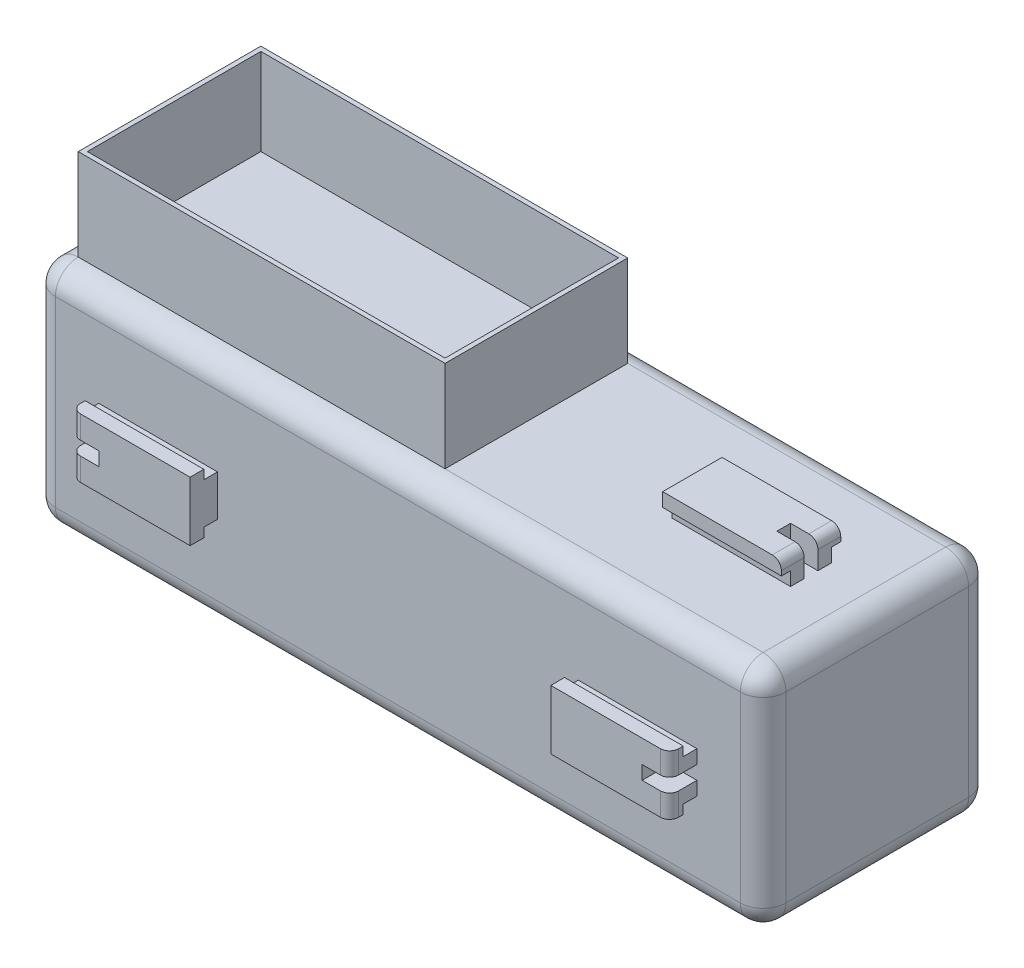
from build123d import *

# Parameters (mm, degrees)
SKETCH1_W               = 160
SKETCH1_H               = 50
BOSS_EXTRUDE1_DEPTH     = 25
SKETCH2_W               = 26
SKETCH2_H               = 13
CONNECTOR_BASE_DEPTH    = 6
SKETCH3_W               = 2
SKETCH3_H               = 3
DOVETAIL_CUT_DEPTH      = 151.851748415
FILLET1_R               = 2
SKETCH4_W               = 3
SKETCH4_H               = 6
CUT_EXTRUDE1_DEPTH      = 6
CIRPATTERN1_START       = -4.5
CIRPATTERN1_OUTLINE_W   = 20
CIRPATTERN1_OUTLINE_H   = 6
CIRPATTERN1_DEPTH       = 9
CIRPATTERN1_START_2     = -6.5
CIRPATTERN1_2_OUTLINE_W = 20
CIRPATTERN1_2_OUTLINE_H = 3
CIRPATTERN1_2_DEPTH     = 13
CIRPATTERN1_3_DEPTH     = 3
CIRPATTERN1_START_3     = 1.5
CIRPATTERN1_4_DEPTH     = 3
CIRPATTERN1_5_DEPTH     = 2
CIRPATTERN1_START_4     = 4.5
CIRPATTERN1_6_DEPTH     = 2
CIRPATTERN1_7_OUTLINE_W = 20
CIRPATTERN1_7_OUTLINE_H = 6
CIRPATTERN1_7_DEPTH     = 9
CIRPATTERN1_8_OUTLINE_W = 20
CIRPATTERN1_8_OUTLINE_H = 3
CIRPATTERN1_8_DEPTH     = 13
CIRPATTERN1_9_DEPTH     = 3
CIRPATTERN1_10_DEPTH    = 3
CIRPATTERN1_11_DEPTH    = 2
CIRPATTERN1_12_DEPTH    = 2
MIRROR1_START           = -4.5
MIRROR1_OUTLINE_W       = 20
MIRROR1_OUTLINE_H       = 6
MIRROR1_DEPTH           = 9
MIRROR1_START_2         = -6.5
MIRROR1_2_OUTLINE_W     = 20
MIRROR1_2_OUTLINE_H     = 3
MIRROR1_2_DEPTH         = 13
MIRROR1_3_DEPTH         = 3
MIRROR1_START_3         = 1.5
MIRROR1_4_DEPTH         = 3
MIRROR1_5_DEPTH         = 2
MIRROR1_START_4         = 4.5
MIRROR1_6_DEPTH         = 2
MIRROR1_7_OUTLINE_W     = 20
MIRROR1_7_OUTLINE_H     = 6
MIRROR1_7_DEPTH         = 9
MIRROR1_8_OUTLINE_W     = 20
MIRROR1_8_OUTLINE_H     = 3
MIRROR1_8_DEPTH         = 13
MIRROR1_9_DEPTH         = 3
MIRROR1_10_DEPTH        = 3
MIRROR1_11_DEPTH        = 2
MIRROR1_12_DEPTH        = 2
FILLET2_R               = 5
SKETCH5_W               = 26
SKETCH5_H               = 13
CUT_EXTRUDE2_DEPTH      = 103.454868113
SKETCH6_W               = 80.339783693
SKETCH6_H               = 40
BOSS_EXTRUDE2_DEPTH     = 20
SHELL1_T                = -1


# Read off the part's stored shape, not the designer's step: CirPattern1, Mirror1
with BuildPart() as part:
    # Sketch1 → Boss-Extrude1 (new, symmetric)
    with BuildSketch(Plane(origin=(0, 0, 0), x_dir=(1, 0, 0), z_dir=(0, 1, 0))):
        Rectangle(SKETCH1_W, SKETCH1_H)
    extrude(amount=BOSS_EXTRUDE1_DEPTH, both=True)

    # Sketch2 → connector base (add)
    with BuildSketch(Plane(origin=(0, 25, 0), x_dir=(1, 0, 0), z_dir=(0, 1, 0))):
        with Locations((-52.5, 0)):
            Rectangle(SKETCH2_W, SKETCH2_H)
    extrude(amount=CONNECTOR_BASE_DEPTH)

    # Sketch3 → dovetail cut (cut, through all)
    with BuildSketch(Plane.ZY.offset(65.5)):
        with Locations((5.5, 26.5)):
            Rectangle(SKETCH3_W, SKETCH3_H)
        with Locations((-5.5, 26.5)):
            Rectangle(SKETCH3_W, SKETCH3_H)
    extrude(amount=-DOVETAIL_CUT_DEPTH, mode=Mode.SUBTRACT)

    # Fillet1
    fillet1_edges = [part.edges().sort_by_distance(p)[0] for p in [
        (-65.5, 31, 0),
    ]]
    fillet(fillet1_edges, radius=FILLET1_R)

    # Sketch4 → Cut-Extrude1 (cut)
    with BuildSketch(Plane.ZY.offset(65.5)):
        with Locations((0, 28)):
            Rectangle(SKETCH4_W, SKETCH4_H)
    extrude(amount=-CUT_EXTRUDE1_DEPTH, mode=Mode.SUBTRACT)

    # CirPattern1 outline → CirPattern1 (add)
    with BuildSketch(Plane(origin=(0, 0, 0), x_dir=(1, 0, 0), z_dir=(0, 1, 0)).offset(CIRPATTERN1_START)):
        with Locations((-49.5, 28)):
            Rectangle(CIRPATTERN1_OUTLINE_W, CIRPATTERN1_OUTLINE_H)
        with Locations((-49.5, -28)):
            Rectangle(CIRPATTERN1_OUTLINE_W, CIRPATTERN1_OUTLINE_H)
    extrude(amount=CIRPATTERN1_DEPTH)

    # CirPattern1 2 outline → CirPattern1 2 (add)
    with BuildSketch(Plane(origin=(0, 0, 0), x_dir=(1, 0, 0), z_dir=(0, 1, 0)).offset(CIRPATTERN1_START_2)):
        with Locations((-49.5, 29.5)):
            Rectangle(CIRPATTERN1_2_OUTLINE_W, CIRPATTERN1_2_OUTLINE_H)
        with Locations((-49.5, -29.5)):
            Rectangle(CIRPATTERN1_2_OUTLINE_W, CIRPATTERN1_2_OUTLINE_H)
    extrude(amount=CIRPATTERN1_2_DEPTH)

    # CirPattern1 3 outline → CirPattern1 3 (add)
    with BuildSketch(Plane(origin=(0, 0, 0), x_dir=(1, 0, 0), z_dir=(0, 1, 0)).offset(CIRPATTERN1_START)):
        with BuildLine():
            Line((-65.5, 25), (-59.5, 25))
            Line((-59.5, 25), (-59.5, 31))
            Line((-59.5, 31), (-63.5, 31))
            ThreePointArc((-63.5, 31), (-64.914213562, 30.414213562), (-65.5, 29))
            Line((-65.5, 29), (-65.5, 25))
        make_face()
        with BuildLine():
            ThreePointArc((-65.5, -29), (-64.914213562, -30.414213562), (-63.5, -31))
            Line((-63.5, -31), (-59.5, -31))
            Line((-59.5, -31), (-59.5, -25))
            Line((-59.5, -25), (-65.5, -25))
            Line((-65.5, -25), (-65.5, -29))
        make_face()
    extrude(amount=CIRPATTERN1_3_DEPTH)

    # CirPattern1 4 outline → CirPattern1 4 (add)
    with BuildSketch(Plane(origin=(0, 0, 0), x_dir=(1, 0, 0), z_dir=(0, 1, 0)).offset(CIRPATTERN1_START_3)):
        with BuildLine():
            Line((-65.5, 25), (-59.5, 25))
            Line((-59.5, 25), (-59.5, 31))
            Line((-59.5, 31), (-63.5, 31))
            ThreePointArc((-63.5, 31), (-64.914213562, 30.414213562), (-65.5, 29))
            Line((-65.5, 29), (-65.5, 25))
        make_face()
        with BuildLine():
            ThreePointArc((-65.5, -29), (-64.914213562, -30.414213562), (-63.5, -31))
            Line((-63.5, -31), (-59.5, -31))
            Line((-59.5, -31), (-59.5, -25))
            Line((-59.5, -25), (-65.5, -25))
            Line((-65.5, -25), (-65.5, -29))
        make_face()
    extrude(amount=CIRPATTERN1_4_DEPTH)

    # CirPattern1 5 outline → CirPattern1 5 (add)
    with BuildSketch(Plane(origin=(0, 0, 0), x_dir=(1, 0, 0), z_dir=(0, 1, 0)).offset(CIRPATTERN1_START_2)):
        with BuildLine():
            Line((-65.5, 29), (-65.5, 28))
            Line((-65.5, 28), (-59.5, 28))
            Line((-59.5, 28), (-59.5, 31))
            Line((-59.5, 31), (-63.5, 31))
            ThreePointArc((-63.5, 31), (-64.914213562, 30.414213562), (-65.5, 29))
        make_face()
        with BuildLine():
            Line((-65.5, -28), (-65.5, -29))
            ThreePointArc((-65.5, -29), (-64.914213562, -30.414213562), (-63.5, -31))
            Line((-63.5, -31), (-59.5, -31))
            Line((-59.5, -31), (-59.5, -28))
            Line((-59.5, -28), (-65.5, -28))
        make_face()
    extrude(amount=CIRPATTERN1_5_DEPTH)

    # CirPattern1 6 outline → CirPattern1 6 (add)
    with BuildSketch(Plane(origin=(0, 0, 0), x_dir=(1, 0, 0), z_dir=(0, 1, 0)).offset(CIRPATTERN1_START_4)):
        with BuildLine():
            Line((-65.5, 29), (-65.5, 28))
            Line((-65.5, 28), (-59.5, 28))
            Line((-59.5, 28), (-59.5, 31))
            Line((-59.5, 31), (-63.5, 31))
            ThreePointArc((-63.5, 31), (-64.914213562, 30.414213562), (-65.5, 29))
        make_face()
        with BuildLine():
            Line((-65.5, -28), (-65.5, -29))
            ThreePointArc((-65.5, -29), (-64.914213562, -30.414213562), (-63.5, -31))
            Line((-63.5, -31), (-59.5, -31))
            Line((-59.5, -31), (-59.5, -28))
            Line((-59.5, -28), (-65.5, -28))
        make_face()
    extrude(amount=CIRPATTERN1_6_DEPTH)

    # CirPattern1 7 outline → CirPattern1 7 (add)
    with BuildSketch(Plane.XY.offset(CIRPATTERN1_START)):
        with Locations((-49.5, -28)):
            Rectangle(CIRPATTERN1_7_OUTLINE_W, CIRPATTERN1_7_OUTLINE_H)
    extrude(amount=CIRPATTERN1_7_DEPTH)

    # CirPattern1 8 outline → CirPattern1 8 (add)
    with BuildSketch(Plane.XY.offset(CIRPATTERN1_START_2)):
        with Locations((-49.5, -29.5)):
            Rectangle(CIRPATTERN1_8_OUTLINE_W, CIRPATTERN1_8_OUTLINE_H)
    extrude(amount=CIRPATTERN1_8_DEPTH)

    # CirPattern1 9 outline → CirPattern1 9 (add)
    with BuildSketch(Plane.XY.offset(CIRPATTERN1_START)):
        with BuildLine():
            ThreePointArc((-65.5, -29), (-64.914213562, -30.414213562), (-63.5, -31))
            Line((-63.5, -31), (-59.5, -31))
            Line((-59.5, -31), (-59.5, -25))
            Line((-59.5, -25), (-65.5, -25))
            Line((-65.5, -25), (-65.5, -29))
        make_face()
    extrude(amount=CIRPATTERN1_9_DEPTH)

    # CirPattern1 10 outline → CirPattern1 10 (add)
    with BuildSketch(Plane.XY.offset(CIRPATTERN1_START_3)):
        with BuildLine():
            ThreePointArc((-65.5, -29), (-64.914213562, -30.414213562), (-63.5, -31))
            Line((-63.5, -31), (-59.5, -31))
            Line((-59.5, -31), (-59.5, -25))
            Line((-59.5, -25), (-65.5, -25))
            Line((-65.5, -25), (-65.5, -29))
        make_face()
    extrude(amount=CIRPATTERN1_10_DEPTH)

    # CirPattern1 11 outline → CirPattern1 11 (add)
    with BuildSketch(Plane.XY.offset(CIRPATTERN1_START_2)):
        with BuildLine():
            Line((-65.5, -28), (-65.5, -29))
            ThreePointArc((-65.5, -29), (-64.914213562, -30.414213562), (-63.5, -31))
            Line((-63.5, -31), (-59.5, -31))
            Line((-59.5, -31), (-59.5, -28))
            Line((-59.5, -28), (-65.5, -28))
        make_face()
    extrude(amount=CIRPATTERN1_11_DEPTH)

    # CirPattern1 12 outline → CirPattern1 12 (add)
    with BuildSketch(Plane.XY.offset(CIRPATTERN1_START_4)):
        with BuildLine():
            Line((-65.5, -28), (-65.5, -29))
            ThreePointArc((-65.5, -29), (-64.914213562, -30.414213562), (-63.5, -31))
            Line((-63.5, -31), (-59.5, -31))
            Line((-59.5, -31), (-59.5, -28))
            Line((-59.5, -28), (-65.5, -28))
        make_face()
    extrude(amount=CIRPATTERN1_12_DEPTH)

    # Mirror1 outline → Mirror1 (add)
    with BuildSketch(Plane.XY.offset(MIRROR1_START)):
        with Locations((49.5, 28)):
            Rectangle(MIRROR1_OUTLINE_W, MIRROR1_OUTLINE_H)
        with Locations((49.5, -28)):
            Rectangle(MIRROR1_OUTLINE_W, MIRROR1_OUTLINE_H)
    extrude(amount=MIRROR1_DEPTH)

    # Mirror1 2 outline → Mirror1 2 (add)
    with BuildSketch(Plane.XY.offset(MIRROR1_START_2)):
        with Locations((49.5, 29.5)):
            Rectangle(MIRROR1_2_OUTLINE_W, MIRROR1_2_OUTLINE_H)
        with Locations((49.5, -29.5)):
            Rectangle(MIRROR1_2_OUTLINE_W, MIRROR1_2_OUTLINE_H)
    extrude(amount=MIRROR1_2_DEPTH)

    # Mirror1 3 outline → Mirror1 3 (add)
    with BuildSketch(Plane.XY.offset(MIRROR1_START)):
        with BuildLine():
            Line((59.5, 25), (65.5, 25))
            Line((65.5, 25), (65.5, 29))
            ThreePointArc((65.5, 29), (64.914213562, 30.414213562), (63.5, 31))
            Line((63.5, 31), (59.5, 31))
            Line((59.5, 31), (59.5, 25))
        make_face()
        with BuildLine():
            ThreePointArc((63.5, -31), (64.914213562, -30.414213562), (65.5, -29))
            Line((65.5, -29), (65.5, -25))
            Line((65.5, -25), (59.5, -25))
            Line((59.5, -25), (59.5, -31))
            Line((59.5, -31), (63.5, -31))
        make_face()
    extrude(amount=MIRROR1_3_DEPTH)

    # Mirror1 4 outline → Mirror1 4 (add)
    with BuildSketch(Plane.XY.offset(MIRROR1_START_3)):
        with BuildLine():
            Line((59.5, 25), (65.5, 25))
            Line((65.5, 25), (65.5, 29))
            ThreePointArc((65.5, 29), (64.914213562, 30.414213562), (63.5, 31))
            Line((63.5, 31), (59.5, 31))
            Line((59.5, 31), (59.5, 25))
        make_face()
        with BuildLine():
            ThreePointArc((63.5, -31), (64.914213562, -30.414213562), (65.5, -29))
            Line((65.5, -29), (65.5, -25))
            Line((65.5, -25), (59.5, -25))
            Line((59.5, -25), (59.5, -31))
            Line((59.5, -31), (63.5, -31))
        make_face()
    extrude(amount=MIRROR1_4_DEPTH)

    # Mirror1 5 outline → Mirror1 5 (add)
    with BuildSketch(Plane.XY.offset(MIRROR1_START_2)):
        with BuildLine():
            Line((59.5, 28), (65.5, 28))
            Line((65.5, 28), (65.5, 29))
            ThreePointArc((65.5, 29), (64.914213562, 30.414213562), (63.5, 31))
            Line((63.5, 31), (59.5, 31))
            Line((59.5, 31), (59.5, 28))
        make_face()
        with BuildLine():
            ThreePointArc((63.5, -31), (64.914213562, -30.414213562), (65.5, -29))
            Line((65.5, -29), (65.5, -28))
            Line((65.5, -28), (59.5, -28))
            Line((59.5, -28), (59.5, -31))
            Line((59.5, -31), (63.5, -31))
        make_face()
    extrude(amount=MIRROR1_5_DEPTH)

    # Mirror1 6 outline → Mirror1 6 (add)
    with BuildSketch(Plane.XY.offset(MIRROR1_START_4)):
        with BuildLine():
            Line((59.5, 28), (65.5, 28))
            Line((65.5, 28), (65.5, 29))
            ThreePointArc((65.5, 29), (64.914213562, 30.414213562), (63.5, 31))
            Line((63.5, 31), (59.5, 31))
            Line((59.5, 31), (59.5, 28))
        make_face()
        with BuildLine():
            ThreePointArc((63.5, -31), (64.914213562, -30.414213562), (65.5, -29))
            Line((65.5, -29), (65.5, -28))
            Line((65.5, -28), (59.5, -28))
            Line((59.5, -28), (59.5, -31))
            Line((59.5, -31), (63.5, -31))
        make_face()
    extrude(amount=MIRROR1_6_DEPTH)

    # Mirror1 7 outline → Mirror1 7 (add)
    with BuildSketch(Plane(origin=(0, 0, 0), x_dir=(1, 0, 0), z_dir=(0, 1, 0)).offset(MIRROR1_START)):
        with Locations((49.5, 28)):
            Rectangle(MIRROR1_7_OUTLINE_W, MIRROR1_7_OUTLINE_H)
        with Locations((49.5, -28)):
            Rectangle(MIRROR1_7_OUTLINE_W, MIRROR1_7_OUTLINE_H)
    extrude(amount=MIRROR1_7_DEPTH)

    # Mirror1 8 outline → Mirror1 8 (add)
    with BuildSketch(Plane(origin=(0, 0, 0), x_dir=(1, 0, 0), z_dir=(0, 1, 0)).offset(MIRROR1_START_2)):
        with Locations((49.5, 29.5)):
            Rectangle(MIRROR1_8_OUTLINE_W, MIRROR1_8_OUTLINE_H)
        with Locations((49.5, -29.5)):
            Rectangle(MIRROR1_8_OUTLINE_W, MIRROR1_8_OUTLINE_H)
    extrude(amount=MIRROR1_8_DEPTH)

    # Mirror1 9 outline → Mirror1 9 (add)
    with BuildSketch(Plane(origin=(0, 0, 0), x_dir=(1, 0, 0), z_dir=(0, 1, 0)).offset(MIRROR1_START)):
        with BuildLine():
            Line((59.5, 25), (65.5, 25))
            Line((65.5, 25), (65.5, 29))
            ThreePointArc((65.5, 29), (64.914213562, 30.414213562), (63.5, 31))
            Line((63.5, 31), (59.5, 31))
            Line((59.5, 31), (59.5, 25))
        make_face()
        with BuildLine():
            ThreePointArc((63.5, -31), (64.914213562, -30.414213562), (65.5, -29))
            Line((65.5, -29), (65.5, -25))
            Line((65.5, -25), (59.5, -25))
            Line((59.5, -25), (59.5, -31))
            Line((59.5, -31), (63.5, -31))
        make_face()
    extrude(amount=MIRROR1_9_DEPTH)

    # Mirror1 10 outline → Mirror1 10 (add)
    with BuildSketch(Plane(origin=(0, 0, 0), x_dir=(1, 0, 0), z_dir=(0, 1, 0)).offset(MIRROR1_START_3)):
        with BuildLine():
            Line((59.5, 25), (65.5, 25))
            Line((65.5, 25), (65.5, 29))
            ThreePointArc((65.5, 29), (64.914213562, 30.414213562), (63.5, 31))
            Line((63.5, 31), (59.5, 31))
            Line((59.5, 31), (59.5, 25))
        make_face()
        with BuildLine():
            ThreePointArc((63.5, -31), (64.914213562, -30.414213562), (65.5, -29))
            Line((65.5, -29), (65.5, -25))
            Line((65.5, -25), (59.5, -25))
            Line((59.5, -25), (59.5, -31))
            Line((59.5, -31), (63.5, -31))
        make_face()
    extrude(amount=MIRROR1_10_DEPTH)

    # Mirror1 11 outline → Mirror1 11 (add)
    with BuildSketch(Plane(origin=(0, 0, 0), x_dir=(1, 0, 0), z_dir=(0, 1, 0)).offset(MIRROR1_START_2)):
        with BuildLine():
            Line((59.5, 28), (65.5, 28))
            Line((65.5, 28), (65.5, 29))
            ThreePointArc((65.5, 29), (64.914213562, 30.414213562), (63.5, 31))
            Line((63.5, 31), (59.5, 31))
            Line((59.5, 31), (59.5, 28))
        make_face()
        with BuildLine():
            ThreePointArc((63.5, -31), (64.914213562, -30.414213562), (65.5, -29))
            Line((65.5, -29), (65.5, -28))
            Line((65.5, -28), (59.5, -28))
            Line((59.5, -28), (59.5, -31))
            Line((59.5, -31), (63.5, -31))
        make_face()
    extrude(amount=MIRROR1_11_DEPTH)

    # Mirror1 12 outline → Mirror1 12 (add)
    with BuildSketch(Plane(origin=(0, 0, 0), x_dir=(1, 0, 0), z_dir=(0, 1, 0)).offset(MIRROR1_START_4)):
        with BuildLine():
            Line((59.5, 28), (65.5, 28))
            Line((65.5, 28), (65.5, 29))
            ThreePointArc((65.5, 29), (64.914213562, 30.414213562), (63.5, 31))
            Line((63.5, 31), (59.5, 31))
            Line((59.5, 31), (59.5, 28))
        make_face()
        with BuildLine():
            ThreePointArc((63.5, -31), (64.914213562, -30.414213562), (65.5, -29))
            Line((65.5, -29), (65.5, -28))
            Line((65.5, -28), (59.5, -28))
            Line((59.5, -28), (59.5, -31))
            Line((59.5, -31), (63.5, -31))
        make_face()
    extrude(amount=MIRROR1_12_DEPTH)

    # Fillet2
    fillet2_edges = [part.edges().sort_by_distance(p)[0] for p in [
        (80, 25, 0),
        (0, 25, -25),
        (-80, 25, 0),
        (0, -25, -25),
        (80, -25, 0),
        (0, -25, 25),
        (-80, -25, 0),
        (-80, 0, -25),
        (80, 0, -25),
        (80, 0, 25),
        (-80, 0, 25),
        (0, 25, 25),
    ]]
    fillet(fillet2_edges, radius=FILLET2_R)

    # Sketch5 → Cut-Extrude2 (cut, through all)
    with BuildSketch(Plane(origin=(0, 25, 0), x_dir=(1, 0, 0), z_dir=(0, 1, 0))):
        with Locations((-52.5, 0)):
            Rectangle(SKETCH5_W, SKETCH5_H)
    extrude(amount=CUT_EXTRUDE2_DEPTH, mode=Mode.SUBTRACT)


with BuildPart() as body_2:
    # Sketch6 → Boss-Extrude2 (new body)
    with BuildSketch(Plane(origin=(0, 25, 0), x_dir=(1, 0, 0), z_dir=(0, 1, 0))):
        with Locations((-34.830108153, 0)):
            Rectangle(SKETCH6_W, SKETCH6_H)
    extrude(amount=BOSS_EXTRUDE2_DEPTH)

    # Shell1
    shell1_openings = [body_2.faces().sort_by_distance(p)[0] for p in [
        (-34.830108153, 45, 0),
    ]]
    offset(amount=SHELL1_T, openings=shell1_openings, kind=Kind.INTERSECTION)


solid = Compound([part.part, body_2.part])
